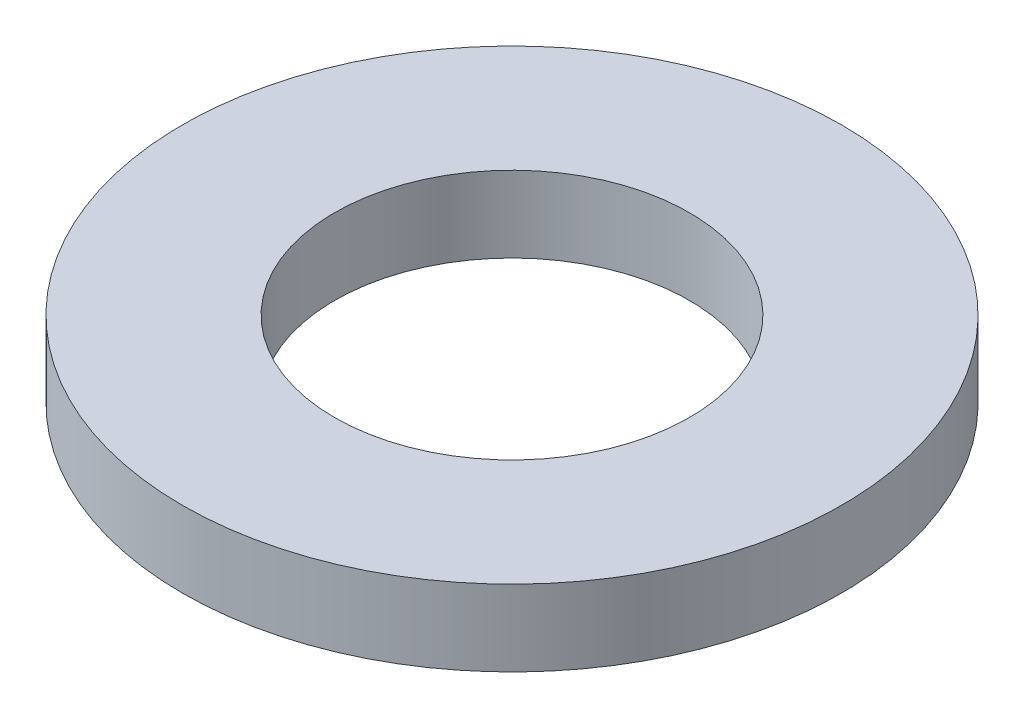
from build123d import *

# Parameters (mm, degrees)
SKETCH1_R           = 6.5
SKETCH1_R_2         = 3.5
BOSS_EXTRUDE1_DEPTH = 1.5


with BuildPart() as part:
    # Sketch1 → Boss-Extrude1 (new body)
    with BuildSketch(Plane(origin=(0, 0, 0), x_dir=(1, 0, 0), z_dir=(0, 1, 0))):
        Circle(SKETCH1_R)
        Circle(SKETCH1_R_2, mode=Mode.SUBTRACT)
    extrude(amount=BOSS_EXTRUDE1_DEPTH)


solid = part.part
